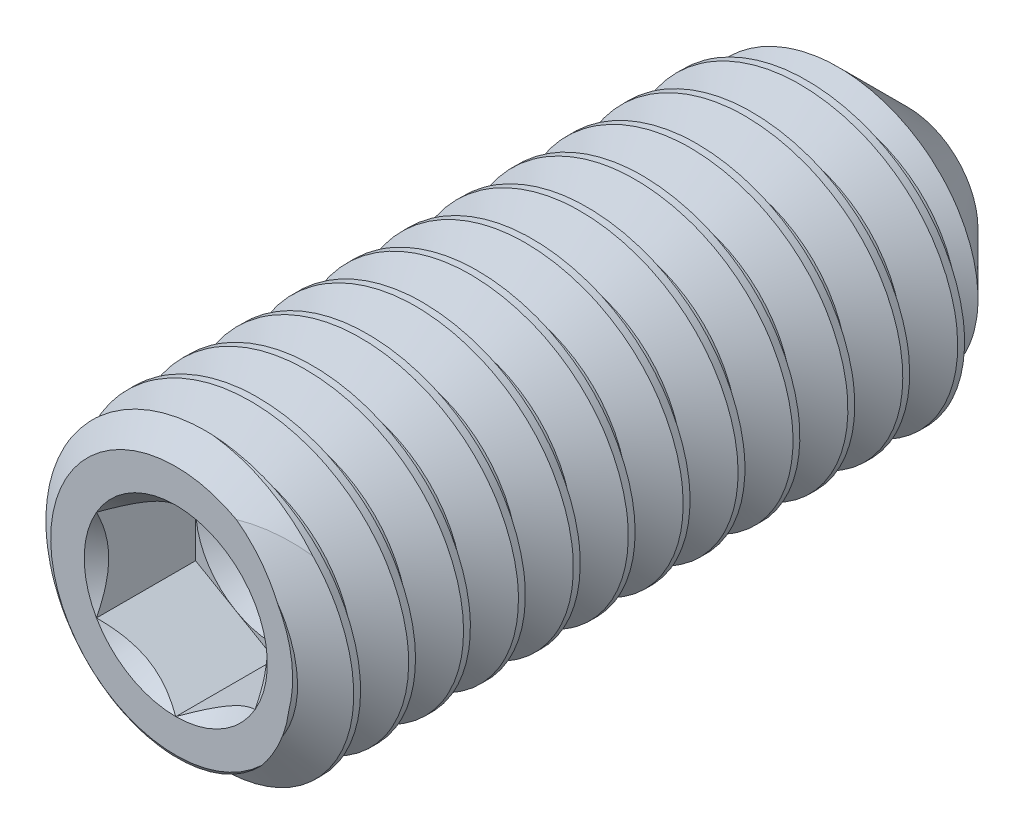
from build123d import *

# Parameters (mm, degrees)
CUT_EXTRUDE1_DEPTH = 0.8125
CUT_SWEEP1_PITCH   = 0.45


with BuildPart() as part:
    # Sketch11 → Revolve1 (revolve)
    with BuildSketch(Plane(origin=(0, 0, 0), x_dir=(0, 0, -1), z_dir=(1, 0, 0)), mode=Mode.PRIVATE) as revolve1_sk:
        Polygon((-3, 0), (-3, 1.025), (-2.842453304, 1.25), (2.325, 1.25), (3, 0.575), (2.654505144, 0), align=None)
    revolve(revolve1_sk.sketch.rotate(Axis((0, 0, -2.654505144), (0, 0, -1)), 180), axis=Axis((0, 0, -2.654505144), (0, 0, -1)))

    # Sketch2 → Cut-Extrude1 (cut)
    with BuildSketch(Plane.XY.offset(3)):
        Polygon((0, 0.75055535), (-0.65, 0.375277675), (-0.65, -0.375277675), (0, -0.75055535), (0.65, -0.375277675), (0.65, 0.375277675), align=None)
    extrude(amount=-CUT_EXTRUDE1_DEPTH, mode=Mode.SUBTRACT)

    # Cut-Extrude2 cone 1 section (through the dimple's axis) → Cut-Extrude2 (revolve, cut)
    with BuildSketch(Plane(origin=(0, 0, 3), x_dir=(0, -1, 0), z_dir=(1, 0, 0))):
        Polygon((0, 0), (0.75055535, 0), (0, 0.75055535), align=None)
    revolve(axis=Axis((0, 0, 3), (0, 0, -1)), mode=Mode.SUBTRACT)

    # Cut-Extrude3 cone 1 section (through the dimple's axis) → Cut-Extrude3 (revolve, cut)
    with BuildSketch(Plane(origin=(0, 0, 2.1875), x_dir=(0, -1, 0), z_dir=(1, 0, 0))):
        Polygon((0, 0), (0.65, 0), (0, 0.375277675), align=None)
    revolve(axis=Axis((0, 0, 2.1875), (0, 0, -1)), mode=Mode.SUBTRACT)

    # Cut-Sweep1: the profile of Sketch6 screwed along a right-hand helix of 14.666667 turns, 6 arcs to a turn; built about Z, then put on its axis
    cut_sweep1_z = Axis((0, 0, 0), (0, 0, 1))
    cut_sweep1_corners = [(1.274356964, 0, 0.0140625), (1.274356964, 0, -0.4078125), (0.957716426, 0, -0.225), (0.957716426, 0, -0.16875)]
    with BuildLine(mode=Mode.PRIVATE) as cut_sweep1_profile:
        Line(cut_sweep1_corners[0], cut_sweep1_corners[1])
        Line(cut_sweep1_corners[1], cut_sweep1_corners[2])
        Line(cut_sweep1_corners[2], cut_sweep1_corners[3])
        Line(cut_sweep1_corners[3], cut_sweep1_corners[0])
    cut_sweep1_cap = Face(cut_sweep1_profile.wire())
    cut_sweep1_turn_angles = [0, 30, 60, 90, 120, 150, 180, 210, 240, 270, 300, 330, 360]
    cut_sweep1_turn_weights = [1, 0.8660254037844387, 1, 0.8660254037844387, 1, 0.8660254037844387, 1, 0.8660254037844387, 1, 0.8660254037844387, 1, 0.8660254037844387, 1]
    cut_sweep1_turn_rails = [Edge.make_bspline([Vector(p[0], p[1], 0).rotate(cut_sweep1_z, cut_sweep1_turn_angles[k]) / cut_sweep1_turn_weights[k] + Vector(0, 0, p[2] + CUT_SWEEP1_PITCH * cut_sweep1_turn_angles[k] / 360) for k in range(13)], [0, 0, 0, 1, 1, 2, 2, 3, 3, 4, 4, 5, 5, 6, 6, 6], 2, cut_sweep1_turn_weights) for p in cut_sweep1_corners]
    cut_sweep1_turn_sides = [Face.make_surface_from_curves(cut_sweep1_turn_rails[p[0]], cut_sweep1_turn_rails[p[1]]) for p in [(0, 1), (1, 2), (2, 3), (3, 0)]]
    cut_sweep1_last_angles = [5040, 5070, 5100, 5130, 5160, 5190, 5220, 5250, 5280]
    cut_sweep1_last_weights = [1, 0.8660254037844387, 1, 0.8660254037844387, 1, 0.8660254037844387, 1, 0.8660254037845021, 1]
    cut_sweep1_last_rails = [Edge.make_bspline([Vector(p[0], p[1], 0).rotate(cut_sweep1_z, cut_sweep1_last_angles[k]) / cut_sweep1_last_weights[k] + Vector(0, 0, p[2] + CUT_SWEEP1_PITCH * cut_sweep1_last_angles[k] / 360) for k in range(9)], [0, 0, 0, 1, 1, 2, 2, 3, 3, 4, 4, 4], 2, cut_sweep1_last_weights) for p in cut_sweep1_corners]
    cut_sweep1_last_sides = [Face.make_surface_from_curves(cut_sweep1_last_rails[p[0]], cut_sweep1_last_rails[p[1]]) for p in [(0, 1), (1, 2), (2, 3), (3, 0)]]
    cut_sweep1 = Plane(origin=(0, 0, -3), x_dir=(0, 1, 0), z_dir=(0, 0, 1)) * Solid(Shell([*[p.moved(Location((0, 0, CUT_SWEEP1_PITCH * i))) for i in range(14) for p in cut_sweep1_turn_sides], *cut_sweep1_last_sides, cut_sweep1_cap, cut_sweep1_cap.rotate(cut_sweep1_z, 5280).moved(Location((0, 0, CUT_SWEEP1_PITCH * 5280 / 360)))]))
    add(cut_sweep1, mode=Mode.SUBTRACT)


solid = part.part
